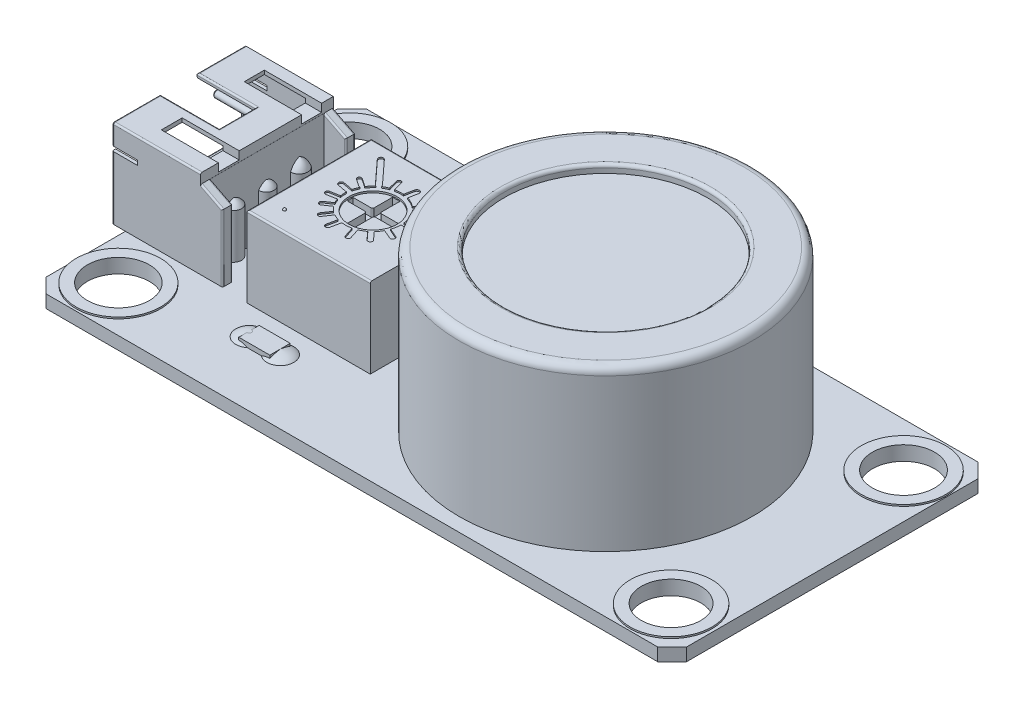
from build123d import *

# Parameters (mm, degrees)
CROQUIS1_W               = 40
CROQUIS1_H               = 20
SALIENTE_EXTRUIR1_DEPTH  = 0.8
CHAFL_N1_SIZE            = 0.9
CROQUIS2_R               = 2.563501178
CROQUIS2_R_2             = 1.863501178
SALIENTE_EXTRUIR2_DEPTH  = 0.1
CROQUIS3_R               = 2.63430269
CROQUIS3_R_2             = 1.93430269
SALIENTE_EXTRUIR3_DEPTH  = 0.1
CROQUIS4_R               = 1.863501178
CORTAR_EXTRUIR1_DEPTH    = 23.419693593
CROQUIS5_R               = 1.93430269
CORTAR_EXTRUIR2_DEPTH    = 23.419693593
CROQUIS6_R               = 2.639737899
CROQUIS6_R_2             = 1.939737899
SALIENTE_EXTRUIR4_DEPTH  = 0.1
CROQUIS7_R               = 1.939737899
CORTAR_EXTRUIR3_DEPTH    = 23.419693593
CROQUIS8_R               = 2.554627201
CROQUIS8_R_2             = 1.854627201
SALIENTE_EXTRUIR5_DEPTH  = 0.1
CROQUIS9_R               = 1.854627201
CORTAR_EXTRUIR4_DEPTH    = 23.419693593
CROQUIS10_R              = 9.147847318
SALIENTE_EXTRUIR6_DEPTH  = 10
REDONDEO1_R              = 0.5
CROQUIS11_R              = 6.347847318
CORTAR_EXTRUIR5_DEPTH    = 0.5
REDONDEO2_R              = 0.2
CROQUIS12_W              = 7.711264444
CROQUIS12_H              = 7.77447153
SALIENTE_EXTRUIR7_DEPTH  = 5
CROQUIS13_W              = 0.487294196
CROQUIS13_H              = 4.644382448
CROQUIS13_W_2            = 0.604282285
CROQUIS13_W_3            = 0.631677662
CORTAR_EXTRUIR6_DEPTH    = 0.5
CROQUIS14_W              = 0.162808197
CROQUIS14_H              = 4.62921408
CORTAR_EXTRUIR7_DEPTH    = 0.5
CROQUIS15_R              = 1.5
CORTAR_EXTRUIR8_DEPTH    = 0.2
CORTAR_EXTRUIR9_DEPTH    = 0.5
CROQUIS17_R              = 1.5
CORTAR_EXTRUIR10_DEPTH   = 0.09
REDONDEO3_R              = 0.1
REDONDEO4_R              = 0.1
CROQUIS19_W              = 1.93781559
CROQUIS19_H              = 1.276122462
SALIENTE_EXTRUIR8_DEPTH  = 0.3
CROQUIS22_W              = 7.711264444
CROQUIS22_H              = 8.280128216
SALIENTE_EXTRUIR9_DEPTH  = 5.5
CROQUIS23_W              = 1.369126528
CROQUIS23_H              = 7.079966235
CORTAR_EXTRUIR11_DEPTH   = 5.5
CORTAR_EXTRUIR12_DEPTH   = 9.5
CROQUIS25_W              = 0.820912642
CROQUIS25_H              = 5.5
CORTAR_EXTRUIR13_DEPTH   = 9.5
CROQUIS30_W              = 7.092837749
CROQUIS30_H              = 0.465863506
CORTAR_EXTRUIR14_DEPTH   = 4.5
CORTAR_EXTRUIR15_DEPTH   = 4.5
CROQUIS32_W              = 1.579361297
CROQUIS32_H              = 0.290202164
CORTAR_EXTRUIR16_DEPTH   = 11.5
CROQUIS33_W              = 4.936040286
CROQUIS33_H              = 2.282665694
CORTAR_EXTRUIR17_DEPTH   = 3.5
CROQUIS34_W              = 3.917666029
CROQUIS34_H              = 1.250479239
CORTAR_EXTRUIR18_DEPTH   = 0.5
CROQUIS35_W              = 5.136503206
CROQUIS35_H              = 1.3
CORTAR_EXTRUIR19_DEPTH   = 0.5
REDONDEO5_R              = 0.1
REDONDEO6_R              = 0.1
CROQUIS36_R              = 0.212902741
SALIENTE_EXTRUIR10_DEPTH = 4.5
REDONDEO7_SIZE           = 0.1


with BuildPart() as part:
    # Croquis1 → Saliente-Extruir1 (new body)
    with BuildSketch(Plane(origin=(0, 0, 0), x_dir=(1, 0, 0), z_dir=(0, 1, 0))):
        Rectangle(CROQUIS1_W, CROQUIS1_H)
    extrude(amount=SALIENTE_EXTRUIR1_DEPTH)

    # Chaflán1
    chafl_n1_edges = [part.edges().sort_by_distance(p)[0] for p in [
        (-20, 0.4, -10),
        (20, 0.4, -10),
        (20, 0.4, 10),
        (-20, 0.4, 10),
    ]]
    chamfer(chafl_n1_edges, length=CHAFL_N1_SIZE)

    # Croquis2 → Saliente-Extruir2 (add)
    with BuildSketch(Plane(origin=(0, 0.8, 0), x_dir=(1, 0, 0), z_dir=(0, 1, 0))):
        with Locations(Location((-17.486502833, 7.354431697, 0), (0, 0, 168.664732408))):
            Circle(CROQUIS2_R)
        with Locations(Location((-17.486502833, 7.354431697, 0), (0, 0, 270))):
            Circle(CROQUIS2_R_2, mode=Mode.SUBTRACT)
    extrude(amount=SALIENTE_EXTRUIR2_DEPTH)

    # Croquis3 → Saliente-Extruir3 (add)
    with BuildSketch(Plane(origin=(0, 0.8, 0), x_dir=(1, 0, 0), z_dir=(0, 1, 0))):
        with Locations(Location((-17.343743463, -7.237211302, 0), (0, 0, 270))):
            Circle(CROQUIS3_R)
        with Locations(Location((-17.343743463, -7.237211302, 0), (0, 0, 270))):
            Circle(CROQUIS3_R_2, mode=Mode.SUBTRACT)
    extrude(amount=SALIENTE_EXTRUIR3_DEPTH)

    # Croquis4 → Cortar-Extruir1 (cut, through all)
    with BuildSketch(Plane(origin=(0, 0.8, 0), x_dir=(1, 0, 0), z_dir=(0, 1, 0))):
        with Locations(Location((-17.486502833, 7.354431697, 0), (0, 0, 270))):
            Circle(CROQUIS4_R)
    extrude(amount=-CORTAR_EXTRUIR1_DEPTH, mode=Mode.SUBTRACT)

    # Croquis5 → Cortar-Extruir2 (cut, through all)
    with BuildSketch(Plane(origin=(0, 0.8, 0), x_dir=(1, 0, 0), z_dir=(0, 1, 0))):
        with Locations(Location((-17.343743463, -7.237211302, 0), (0, 0, 270))):
            Circle(CROQUIS5_R)
    extrude(amount=-CORTAR_EXTRUIR2_DEPTH, mode=Mode.SUBTRACT)

    # Croquis6 → Saliente-Extruir4 (add)
    with BuildSketch(Plane(origin=(0, 0.8, 0), x_dir=(1, 0, 0), z_dir=(0, 1, 0))):
        with Locations(Location((17.305953642, 7.142905367, 0), (0, 0, 270))):
            Circle(CROQUIS6_R)
        with Locations(Location((17.305953642, 7.142905367, 0), (0, 0, 270))):
            Circle(CROQUIS6_R_2, mode=Mode.SUBTRACT)
    extrude(amount=SALIENTE_EXTRUIR4_DEPTH)

    # Croquis7 → Cortar-Extruir3 (cut, through all)
    with BuildSketch(Plane(origin=(0, 0.8, 0), x_dir=(1, 0, 0), z_dir=(0, 1, 0))):
        with Locations(Location((17.305953642, 7.142905367, 0), (0, 0, 270))):
            Circle(CROQUIS7_R)
    extrude(amount=-CORTAR_EXTRUIR3_DEPTH, mode=Mode.SUBTRACT)

    # Croquis8 → Saliente-Extruir5 (add)
    with BuildSketch(Plane(origin=(0, 0.8, 0), x_dir=(1, 0, 0), z_dir=(0, 1, 0))):
        with Locations(Location((17.258545284, -7.324743745, 0), (0, 0, 270))):
            Circle(CROQUIS8_R)
        with Locations(Location((17.258545284, -7.324743745, 0), (0, 0, 270))):
            Circle(CROQUIS8_R_2, mode=Mode.SUBTRACT)
    extrude(amount=SALIENTE_EXTRUIR5_DEPTH)

    # Croquis9 → Cortar-Extruir4 (cut, through all)
    with BuildSketch(Plane(origin=(0, 0.8, 0), x_dir=(1, 0, 0), z_dir=(0, 1, 0))):
        with Locations(Location((17.258545284, -7.324743745, 0), (0, 0, 270))):
            Circle(CROQUIS9_R)
    extrude(amount=-CORTAR_EXTRUIR4_DEPTH, mode=Mode.SUBTRACT)

    # Croquis10 → Saliente-Extruir6 (add)
    with BuildSketch(Plane(origin=(0, 0.8, 0), x_dir=(1, 0, 0), z_dir=(0, 1, 0))):
        with Locations(Location((5.853256957, 0, 0), (0, 0, 270))):
            Circle(CROQUIS10_R)
    extrude(amount=SALIENTE_EXTRUIR6_DEPTH)

    # Redondeo1
    redondeo1_edges = [part.edges().sort_by_distance(p)[0] for p in [
        (5.853256957, 10.8, -9.147847318),
    ]]
    fillet(redondeo1_edges, radius=REDONDEO1_R)

    # Croquis11 → Cortar-Extruir5 (cut)
    with BuildSketch(Plane(origin=(0, 10.8, 0), x_dir=(1, 0, 0), z_dir=(0, 1, 0))):
        with Locations(Location((5.853256957, 0, 0), (0, 0, 270))):
            Circle(CROQUIS11_R)
    extrude(amount=-CORTAR_EXTRUIR5_DEPTH, mode=Mode.SUBTRACT)

    # Redondeo2
    redondeo2_edges = [part.edges().sort_by_distance(p)[0] for p in [
        (5.853256957, 10.8, -6.347847318),
    ]]
    fillet(redondeo2_edges, radius=REDONDEO2_R)

    # Croquis12 → Saliente-Extruir7 (add)
    with BuildSketch(Plane(origin=(0, 0.8, 0), x_dir=(1, 0, 0), z_dir=(0, 1, 0))):
        with Locations((-8.486038846, -0.334001576)):
            Rectangle(CROQUIS12_W, CROQUIS12_H)
    extrude(amount=SALIENTE_EXTRUIR7_DEPTH)

    # Croquis13 → Cortar-Extruir6 (cut)
    with BuildSketch(Plane.ZY.offset(12.341671068)):
        with Locations((-3.004542589, 3.122191224)):
            Rectangle(CROQUIS13_W, CROQUIS13_H)
        with Locations((0.031860434, 3.122191224)):
            Rectangle(CROQUIS13_W_2, CROQUIS13_H)
        with Locations((3.528809231, 3.122191224)):
            Rectangle(CROQUIS13_W_3, CROQUIS13_H)
    extrude(amount=-CORTAR_EXTRUIR6_DEPTH, mode=Mode.SUBTRACT)

    # Croquis14 → Cortar-Extruir7 (cut)
    with BuildSketch(Plane.ZY.offset(12.341671068)):
        with Locations((0.602339698, 3.11460704)):
            Rectangle(CROQUIS14_W, CROQUIS14_H)
    extrude(amount=-CORTAR_EXTRUIR7_DEPTH, mode=Mode.SUBTRACT)

    # Croquis15 → Cortar-Extruir8 (cut)
    with BuildSketch(Plane(origin=(0, 5.8, 0), x_dir=(1, 0, 0), z_dir=(0, 1, 0))):
        with Locations(Location((-8.486038846, -0.193365188, 0), (0, 0, 270))):
            Circle(CROQUIS15_R)
    extrude(amount=-CORTAR_EXTRUIR8_DEPTH, mode=Mode.SUBTRACT)

    # Croquis16 → Cortar-Extruir9 (cut)
    with BuildSketch(Plane(origin=(0, 5.6, 0), x_dir=(1, 0, 0), z_dir=(0, 1, 0))):
        Polygon((-8.613079471, -1.605053744), (-8.299530316, -1.605053744), (-8.247956714, -1.605053744), (-8.247956714, -0.372873894), (-7.061522222, -0.372873894), (-7.061522222, -0.312883922), (-7.061522222, -0.077891256), (-7.061522222, 0), (-8.247956714, 0), (-8.247956714, 1.242381616), (-8.299530316, 1.242381616), (-8.613079471, 1.242381616), (-8.703811896, 1.242381616), (-8.703811896, 0), (-9.914219858, 0), (-9.914219858, -0.077891256), (-9.914219858, -0.312883922), (-9.914219858, -0.372873894), (-8.703811896, -0.372873894), (-8.703811896, -1.605053744), align=None)
    extrude(amount=-CORTAR_EXTRUIR9_DEPTH, mode=Mode.SUBTRACT)

    # Croquis17 → Cortar-Extruir10 (cut)
    with BuildSketch(Plane(origin=(0, 5.8, 0), x_dir=(1, 0, 0), z_dir=(0, 1, 0))):
        with BuildLine():
            Line((-6.752367186, 0), (-5.255463579, 0))
            ThreePointArc((-5.255463579, 0), (-5.133083695, -0.092725715), (-5.24904313, -0.193365188))
            Line((-5.24904313, -0.193365188), (-6.741617016, -0.193365188))
            ThreePointArc((-6.741617016, -0.193365188), (-6.764169107, -0.472957969), (-6.831242268, -0.745321533))
            ThreePointArc((-6.831242268, -0.745321533), (-6.828446206, -0.74641833), (-6.825673504, -0.747572906))
            Line((-6.825673504, -0.747572906), (-6.275797031, -0.983269507))
            ThreePointArc((-6.275797031, -0.983269507), (-6.199782388, -1.17333597), (-6.389848851, -1.249350614))
            Line((-6.389848851, -1.249350614), (-6.939725324, -1.013654012))
            ThreePointArc((-6.939725324, -1.013654012), (-6.942473474, -1.012442155), (-6.945195887, -1.011173538))
            ThreePointArc((-6.945195887, -1.011173538), (-7.067088863, -1.208051576), (-7.213984234, -1.387050484))
            ThreePointArc((-7.213984234, -1.387050484), (-7.211925813, -1.389192151), (-7.209912021, -1.391375836))
            Line((-7.209912021, -1.391375836), (-6.77587672, -1.871883467))
            ThreePointArc((-6.77587672, -1.871883467), (-6.786208084, -2.075197491), (-6.989522108, -2.064866127))
            Line((-6.989522108, -2.064866127), (-7.42355741, -1.584358497))
            ThreePointArc((-7.42355741, -1.584358497), (-7.425525713, -1.582133723), (-7.427447691, -1.579868808))
            ThreePointArc((-7.427447691, -1.579868808), (-7.616764452, -1.705770408), (-7.820847714, -1.805980542))
            ThreePointArc((-7.820847714, -1.805980542), (-7.819903287, -1.808642589), (-7.819012615, -1.811323099))
            Line((-7.819012615, -1.811323099), (-7.619331434, -2.433108693))
            ThreePointArc((-7.619331434, -2.433108693), (-7.710060354, -2.609678259), (-7.886629919, -2.518949339))
            Line((-7.886629919, -2.518949339), (-8.0863111, -1.897163746))
            ThreePointArc((-8.0863111, -1.897163746), (-8.087147656, -1.894465856), (-8.087929758, -1.89175168))
            ThreePointArc((-8.087929758, -1.89175168), (-8.395496384, -1.935435676), (-8.705934461, -1.923871888))
            ThreePointArc((-8.705934461, -1.923871888), (-8.706461582, -1.926801321), (-8.707049099, -1.92971924))
            Line((-8.707049099, -1.92971924), (-8.838377518, -2.548849209))
            ThreePointArc((-8.838377518, -2.548849209), (-9.009236256, -2.659908207), (-9.120295254, -2.48904947))
            Line((-9.120295254, -2.48904947), (-8.988966835, -1.869919501))
            ThreePointArc((-8.988966835, -1.869919501), (-8.988319173, -1.867014339), (-8.987611643, -1.864123175))
            ThreePointArc((-8.987611643, -1.864123175), (-9.171113496, -1.797634569), (-9.346039293, -1.711063034))
            ThreePointArc((-9.346039293, -1.711063034), (-9.347594427, -1.713508113), (-9.349199068, -1.71592099))
            Line((-9.349199068, -1.71592099), (-9.694365309, -2.223644587))
            ThreePointArc((-9.694365309, -2.223644587), (-9.891878046, -2.261289716), (-9.929523175, -2.063776979))
            Line((-9.929523175, -2.063776979), (-9.584356935, -1.556053382))
            ThreePointArc((-9.584356935, -1.556053382), (-9.582703452, -1.553673709), (-9.581001815, -1.551328228))
            ThreePointArc((-9.581001815, -1.551328228), (-9.720218731, -1.42616993), (-9.845221747, -1.286813569))
            ThreePointArc((-9.845221747, -1.286813569), (-9.847555366, -1.288503156), (-9.849922838, -1.290144971))
            Line((-9.849922838, -1.290144971), (-10.314199097, -1.605177444))
            ThreePointArc((-10.314199097, -1.605177444), (-10.511109712, -1.567467504), (-10.473399772, -1.370556889))
            Line((-10.473399772, -1.370556889), (-10.009123513, -1.055524416))
            ThreePointArc((-10.009123513, -1.055524416), (-10.006723166, -1.05393105), (-10.004290935, -1.052386792))
            ThreePointArc((-10.004290935, -1.052386792), (-10.075810654, -0.911441172), (-10.134279577, -0.764600704))
            ThreePointArc((-10.134279577, -0.764600704), (-10.164472454, -0.782617667), (-10.198112844, -0.792842387))
            Line((-10.198112844, -0.792842387), (-10.742016536, -0.888223224))
            ThreePointArc((-10.742016536, -0.888223224), (-10.909977963, -0.770381269), (-10.792136008, -0.602419842))
            Line((-10.792136008, -0.602419842), (-10.248232316, -0.507039004))
            ThreePointArc((-10.248232316, -0.507039004), (-10.225214961, -0.504872738), (-10.202145745, -0.506390161))
            ThreePointArc((-10.202145745, -0.506390161), (-10.226791534, -0.30644746), (-10.228220958, -0.104996583))
            ThreePointArc((-10.228220958, -0.104996583), (-10.252855928, -0.106210992), (-10.277376419, -0.103546027))
            Line((-10.277376419, -0.103546027), (-10.854762333, 0.005710848))
            ThreePointArc((-10.854762333, 0.005710848), (-10.979635034, 0.188871755), (-10.796474127, 0.313744456))
            Line((-10.796474127, 0.313744456), (-10.219088213, 0.204487582))
            ThreePointArc((-10.219088213, 0.204487582), (-10.202657027, 0.200448935), (-10.186756882, 0.194662753))
            ThreePointArc((-10.186756882, 0.194662753), (-10.1316672, 0.385353086), (-10.055271645, 0.568550781))
            ThreePointArc((-10.055271645, 0.568550781), (-10.104393581, 0.569344427), (-10.149670062, 0.588413639))
            Line((-10.149670062, 0.588413639), (-10.608812421, 0.895741177))
            ThreePointArc((-10.608812421, 0.895741177), (-10.644323507, 1.07502656), (-10.465038125, 1.110537646))
            Line((-10.465038125, 1.110537646), (-10.005895765, 0.803210108))
            ThreePointArc((-10.005895765, 0.803210108), (-9.977201908, 0.776963609), (-9.95761468, 0.743369612))
            ThreePointArc((-9.95761468, 0.743369612), (-9.80782251, 0.945008856), (-9.630623453, 1.12304417))
            ThreePointArc((-9.630623453, 1.12304417), (-9.667998659, 1.140299707), (-9.699573292, 1.166713758))
            Line((-9.699573292, 1.166713758), (-11.03603756, 2.62422304))
            ThreePointArc((-11.03603756, 2.62422304), (-11.026468931, 2.845087125), (-10.805604846, 2.835518496))
            Line((-10.805604846, 2.835518496), (-9.469140578, 1.378009213))
            ThreePointArc((-9.469140578, 1.378009213), (-9.43912712, 1.330193588), (-9.42805552, 1.274835107))
            ThreePointArc((-9.42805552, 1.274835107), (-9.258521447, 1.370693043), (-9.079358518, 1.447055272))
            ThreePointArc((-9.079358518, 1.447055272), (-9.101983975, 1.475755151), (-9.115785464, 1.509594674))
            Line((-9.115785464, 1.509594674), (-9.247113883, 2.030240829))
            ThreePointArc((-9.247113883, 2.030240829), (-9.152284139, 2.189048343), (-8.993476625, 2.094218599))
            Line((-8.993476625, 2.094218599), (-8.862148206, 1.573572445))
            ThreePointArc((-8.862148206, 1.573572445), (-8.858176172, 1.541820118), (-8.862033321, 1.510053632))
            ThreePointArc((-8.862033321, 1.510053632), (-8.589274007, 1.547999226), (-8.313941877, 1.54254672))
            ThreePointArc((-8.313941877, 1.54254672), (-8.31375673, 1.562616585), (-8.311145262, 1.582516685))
            Line((-8.311145262, 1.582516685), (-8.206057678, 2.125678643))
            ThreePointArc((-8.206057678, 2.125678643), (-8.011991378, 2.256824857), (-7.880845164, 2.062758556))
            Line((-7.880845164, 2.062758556), (-7.985932747, 1.519596598))
            ThreePointArc((-7.985932747, 1.519596598), (-7.990932186, 1.500158508), (-7.998246176, 1.481467887))
            ThreePointArc((-7.998246176, 1.481467887), (-7.673622944, 1.350327761), (-7.381725329, 1.157004826))
            ThreePointArc((-7.381725329, 1.157004826), (-7.368927382, 1.177678119), (-7.352496056, 1.195599726))
            Line((-7.352496056, 1.195599726), (-6.969668216, 1.54158356))
            ThreePointArc((-6.969668216, 1.54158356), (-6.786469257, 1.532322205), (-6.795730612, 1.349123246))
            Line((-6.795730612, 1.349123246), (-7.178558451, 1.003139412))
            ThreePointArc((-7.178558451, 1.003139412), (-7.189489304, 0.994288429), (-7.201314251, 0.986673047))
            ThreePointArc((-7.201314251, 0.986673047), (-7.079578598, 0.838563632), (-6.974831338, 0.677989726))
            ThreePointArc((-6.974831338, 0.677989726), (-6.960254176, 0.68777065), (-6.944649726, 0.695811874))
            Line((-6.944649726, 0.695811874), (-6.54455216, 0.873644287))
            ThreePointArc((-6.54455216, 0.873644287), (-6.343222482, 0.796215233), (-6.420651536, 0.594885556))
            Line((-6.420651536, 0.594885556), (-6.820749102, 0.417053143))
            ThreePointArc((-6.820749102, 0.417053143), (-6.83438993, 0.411758245), (-6.848475361, 0.407794818))
            ThreePointArc((-6.848475361, 0.407794818), (-6.788134033, 0.206793239), (-6.752367186, 0))
        make_face()
        with Locations(Location((-8.486038846, -0.193365188, 0), (0, 0, 270))):
            Circle(CROQUIS17_R, mode=Mode.SUBTRACT)
    extrude(amount=-CORTAR_EXTRUIR10_DEPTH, mode=Mode.SUBTRACT)

    # Redondeo3
    redondeo3_edges = [part.edges().sort_by_distance(p)[0] for p in [
        (-12.341671068, 5.8, 0.334001576),
        (-8.486038846, 5.8, 4.221237341),
        (-8.486038846, 5.8, -3.553234189),
    ]]
    fillet(redondeo3_edges, radius=REDONDEO3_R)

    # Redondeo4
    redondeo4_edges = [part.edges().sort_by_distance(p)[0] for p in [
        (-8.703811896, 5.35, 0.372873894),
        (-8.703811896, 5.35, 0),
        (-8.247956714, 5.35, 0),
        (-8.247956714, 5.35, 0.372873894),
    ]]
    fillet(redondeo4_edges, radius=REDONDEO4_R)

    # Croquis18 → Revolución1 (revolve)
    with BuildSketch(Plane(origin=(0, 5.8, 0), x_dir=(1, 0, 0), z_dir=(0, 1, 0))):
        with BuildLine():
            Line((-11.287068668, -3.00454063), (-11.102235753, -3.00454063))
            ThreePointArc((-11.102235753, -3.00454063), (-11.194652211, -2.912124172), (-11.287068668, -3.00454063))
        make_face()
    revolve(axis=Axis((-11.287068668, 5.8, 3.00454063), (1, 0, 0)))

    # Croquis19 → Saliente-Extruir8 (add)
    with BuildSketch(Plane(origin=(0, 0.8, 0), x_dir=(1, 0, 0), z_dir=(0, 1, 0))):
        with Locations((-9.465419961, -5.991420445)):
            Rectangle(CROQUIS19_W, CROQUIS19_H)
    extrude(amount=SALIENTE_EXTRUIR8_DEPTH)

    # Croquis20 → Revolución2 (revolve)
    with BuildSketch(Plane.XY.offset(5.97)):
        with BuildLine():
            Line((-8.496512166, 1.1), (-8.496512166, 0.8))
            Line((-8.496512166, 0.8), (-7.650096537, 0.8))
            add(Edge.make_bspline(
                [(-8.496512166, 1.1), (-8.205596023, 1.04118429), (-7.887227562, 0.996192946), (-7.650096537, 0.8)],
                knots=[0, 0, 0, 0, 1, 1, 1, 1], degree=3))
        make_face()
    revolve(axis=Axis((-8.496512166, 1.1, 5.97), (0, -1, 0)))

    # Croquis21 → Revolución3 (revolve)
    with BuildSketch(Plane.XY.offset(5.97)):
        with BuildLine():
            Line((-10.434327756, 1.1), (-10.434327756, 0.8))
            Line((-10.434327756, 0.8), (-11.220020356, 0.8))
            Line((-11.220020356, 0.8), (-11.280329691, 0.8))
            add(Edge.make_bspline(
                [(-10.434327756, 1.1), (-10.918604602, 1.127081835), (-11.280329691, 0.8)],
                knots=[0, 0, 0, 1, 1, 1], degree=2))
        make_face()
    revolve(axis=Axis((-10.434327756, 1.1, 5.97), (0, -1, 0)))

    # Croquis22 → Saliente-Extruir9 (add)
    with BuildSketch(Plane(origin=(0, 0.8, 0), x_dir=(1, 0, 0), z_dir=(0, 1, 0))):
        with Locations((-17.786193062, 0)):
            Rectangle(CROQUIS22_W, CROQUIS22_H)
    extrude(amount=SALIENTE_EXTRUIR9_DEPTH)

    # Croquis23 → Cortar-Extruir11 (cut)
    with BuildSketch(Plane(origin=(0, 6.3, 0), x_dir=(1, 0, 0), z_dir=(0, 1, 0))):
        with Locations((-14.615124104, 0.01826936)):
            Rectangle(CROQUIS23_W, CROQUIS23_H)
    extrude(amount=-CORTAR_EXTRUIR11_DEPTH, mode=Mode.SUBTRACT)

    # Croquis24 → Cortar-Extruir12 (cut)
    with BuildSketch(Plane.XY.offset(4.140064108)):
        Polygon((-15.302213168, 6.3), (-15.302213168, 5.684909915), (-13.93056084, 4.988519783), (-13.93056084, 6.3), align=None)
    extrude(amount=-CORTAR_EXTRUIR12_DEPTH, mode=Mode.SUBTRACT)

    # Croquis25 → Cortar-Extruir13 (cut)
    with BuildSketch(Plane.XY.offset(4.140064108)):
        with Locations((-21.231368963, 3.55)):
            Rectangle(CROQUIS25_W, CROQUIS25_H)
    extrude(amount=-CORTAR_EXTRUIR13_DEPTH, mode=Mode.SUBTRACT)

    # Croquis27 → Revolución4 (revolve)
    with BuildSketch(Plane.XY.offset(2.090064108)):
        with BuildLine():
            Line((-15.302213168, 3.950046635), (-15.302213168, 0.8))
            Line((-15.302213168, 0.8), (-14.801160181, 0.8))
            Line((-14.801160181, 0.8), (-14.801160181, 3.6))
            add(Edge.make_bspline(
                [(-14.801160181, 3.6), (-15.001578067, 3.849006989), (-15.302213168, 3.950046635)],
                knots=[0, 0, 0, 1, 1, 1], degree=2))
        make_face()
    revolve(axis=Axis((-15.302213168, 3.950046635, 2.090064108), (0, -1, 0)))

    # Croquis28 → Revolución5 (revolve)
    with BuildSketch(Plane.XY.offset(0.040064108)):
        with BuildLine():
            Line((-15.302213168, 3.893159397), (-15.302213168, 0.8))
            Line((-15.302213168, 0.8), (-14.824987034, 0.8))
            Line((-14.824987034, 0.8), (-14.824987034, 3.55))
            add(Edge.make_bspline(
                [(-14.824987034, 3.55), (-14.993222111, 3.826137643), (-15.302213168, 3.893159397)],
                knots=[0, 0, 0, 1, 1, 1], degree=2))
        make_face()
    revolve(axis=Axis((-15.302213168, 3.893159397, 0.040064108), (0, -1, 0)))

    # Croquis29 → Revolución6 (revolve)
    with BuildSketch(Plane.XY.offset(-2.009935892)):
        with BuildLine():
            Line((-15.302213168, 4.114264325), (-15.302213168, 0.8))
            Line((-15.302213168, 0.8), (-14.764073995, 0.8))
            Line((-14.764073995, 0.8), (-14.764073995, 3.55))
            add(Edge.make_bspline(
                [(-14.764073995, 3.55), (-14.921131227, 3.948170483), (-15.302213168, 4.114264325)],
                knots=[0, 0, 0, 1, 1, 1], degree=2))
        make_face()
    revolve(axis=Axis((-15.302213168, 4.114264325, -2.009935892), (0, -1, 0)))

    # Croquis30 → Cortar-Extruir14 (cut)
    with BuildSketch(Plane.ZY.offset(20.820912642)):
        with Locations((-0.024738815, 1.032931753)):
            Rectangle(CROQUIS30_W, CROQUIS30_H)
    extrude(amount=-CORTAR_EXTRUIR14_DEPTH, mode=Mode.SUBTRACT)

    # Croquis31 → Cortar-Extruir15 (cut)
    with BuildSketch(Plane.ZY.offset(20.820912642)):
        Polygon((-3.934432231, 6.063051888), (-3.934432231, 1.496924787), (3.880322846, 1.496924787), (3.93138207, 1.496924787), (3.93138207, 6.063051888), (3.880322846, 6.063051888), align=None)
    extrude(amount=-CORTAR_EXTRUIR15_DEPTH, mode=Mode.SUBTRACT)

    # Croquis32 → Cortar-Extruir16 (cut)
    with BuildSketch(Plane.XY.offset(4.140064108)):
        with Locations((-20.031231994, 4.883685763)):
            Rectangle(CROQUIS32_W, CROQUIS32_H)
    extrude(amount=-CORTAR_EXTRUIR16_DEPTH, mode=Mode.SUBTRACT)

    # Croquis33 → Cortar-Extruir17 (cut)
    with BuildSketch(Plane(origin=(0, 6.3, 0), x_dir=(1, 0, 0), z_dir=(0, 1, 0))):
        with Locations((-19.605192055, 0)):
            Rectangle(CROQUIS33_W, CROQUIS33_H)
    extrude(amount=-CORTAR_EXTRUIR17_DEPTH, mode=Mode.SUBTRACT)

    # Croquis34 → Cortar-Extruir18 (cut)
    with BuildSketch(Plane(origin=(0, 6.3, 0), x_dir=(1, 0, 0), z_dir=(0, 1, 0))):
        with Locations((-16.920726996, 2.78816712)):
            Rectangle(CROQUIS34_W, CROQUIS34_H)
    extrude(amount=-CORTAR_EXTRUIR18_DEPTH, mode=Mode.SUBTRACT)

    # Croquis35 → Cortar-Extruir19 (cut)
    with BuildSketch(Plane(origin=(0, 6.3, 0), x_dir=(1, 0, 0), z_dir=(0, 1, 0))):
        with Locations((-16.29356015, -2.383269905)):
            Rectangle(CROQUIS35_W, CROQUIS35_H)
    extrude(amount=-CORTAR_EXTRUIR19_DEPTH, mode=Mode.SUBTRACT)

    # Redondeo5
    redondeo5_edges = [part.edges().sort_by_distance(p)[0] for p in [
        (-18.061562905, 6.3, 4.140064108),
        (-20.820912642, 6.3, -2.640698477),
        (-20.820912642, 2.769292341, -4.140064108),
        (-20.820912642, 2.769292341, 4.140064108),
        (-20.820912642, 1.265863506, -0.024738815),
        (-20.820912642, 6.063051888, 2.536357458),
        (-20.820912642, 1.496924787, -0.001525081),
        (-20.820912642, 5.664393423, 4.140064108),
        (-20.820912642, 5.664393423, -4.140064108),
        (-20.820912642, 6.063051888, -2.537882539),
        (-20.820912642, 6.3, 2.640698477),
        (-18.979042277, 6.3, -1.141332847),
        (-18.979042277, 6.3, 1.141332847),
        (-17.137171912, 6.3, 0),
    ]]
    fillet(redondeo5_edges, radius=REDONDEO5_R)

    # Redondeo6
    redondeo6_edges = [part.edges().sort_by_distance(p)[0] for p in [
        (-13.93056084, 2.894259891, -3.558252477),
        (-13.93056084, 2.894259891, 3.521713758),
        (-14.615124104, 5.336073673, -3.558252477),
        (-13.93056084, 2.894259891, -4.140064108),
        (-13.93056084, 2.894259891, 4.140064108),
        (-14.616387004, 5.336714849, -4.140064108),
        (-14.615124104, 5.336073673, 3.521713758),
        (-14.616387004, 5.336714849, 4.140064108),
    ]]
    fillet(redondeo6_edges, radius=REDONDEO6_R)

    # Croquis36 → Saliente-Extruir10 (add)
    with BuildSketch(Plane.ZY.offset(16.320912642)):
        with Locations((0, 4.636720715)):
            Circle(CROQUIS36_R)
        with Locations((-2.331707745, 4.636720715)):
            Circle(CROQUIS36_R)
        with Locations((2.431863744, 4.636720715)):
            Circle(CROQUIS36_R)
    extrude(amount=SALIENTE_EXTRUIR10_DEPTH)

    # Redondeo7
    # a fillet whose section is not a circle: 0.1 mm, written as the material it takes off along each edge
    with BuildSketch(Plane(origin=(-20.820912642, 4.636720715, 0), x_dir=(0, 0, 1), z_dir=(0, -1, 0))) as redondeo7_piece_1:
        with BuildLine():
            Bezier((0.212902741, -REDONDEO7_SIZE), (0.212902741, 0), (0.212902741 - REDONDEO7_SIZE, 0), weights=[1, 0.333333333, 1])
            Line((0.212902741 - REDONDEO7_SIZE, 0), (0.212902741, 0))
            Line((0.212902741, 0), (0.212902741, -REDONDEO7_SIZE))
        make_face()
    revolve(axis=Axis((-20.820912642, 4.636720715, 0), (-1, 0, 0)), mode=Mode.SUBTRACT)
    with BuildSketch(Plane(origin=(-20.820912642, 4.636720715, -2.331707745), x_dir=(0, 0, 1), z_dir=(0, -1, 0))) as redondeo7_piece_2:
        with BuildLine():
            Bezier((0.212902741, -REDONDEO7_SIZE), (0.212902741, 0), (0.212902741 - REDONDEO7_SIZE, 0), weights=[1, 0.333333333, 1])
            Line((0.212902741 - REDONDEO7_SIZE, 0), (0.212902741, 0))
            Line((0.212902741, 0), (0.212902741, -REDONDEO7_SIZE))
        make_face()
    revolve(axis=Axis((-20.820912642, 4.636720715, -2.331707745), (-1, 0, 0)), mode=Mode.SUBTRACT)
    with BuildSketch(Plane(origin=(-20.820912642, 4.636720715, 2.431863744), x_dir=(0, 0, 1), z_dir=(0, -1, 0))) as redondeo7_piece_3:
        with BuildLine():
            Bezier((0.212902741, -REDONDEO7_SIZE), (0.212902741, 0), (0.212902741 - REDONDEO7_SIZE, 0), weights=[1, 0.333333333, 1])
            Line((0.212902741 - REDONDEO7_SIZE, 0), (0.212902741, 0))
            Line((0.212902741, 0), (0.212902741, -REDONDEO7_SIZE))
        make_face()
    revolve(axis=Axis((-20.820912642, 4.636720715, 2.431863744), (-1, 0, 0)), mode=Mode.SUBTRACT)


solid = part.part
